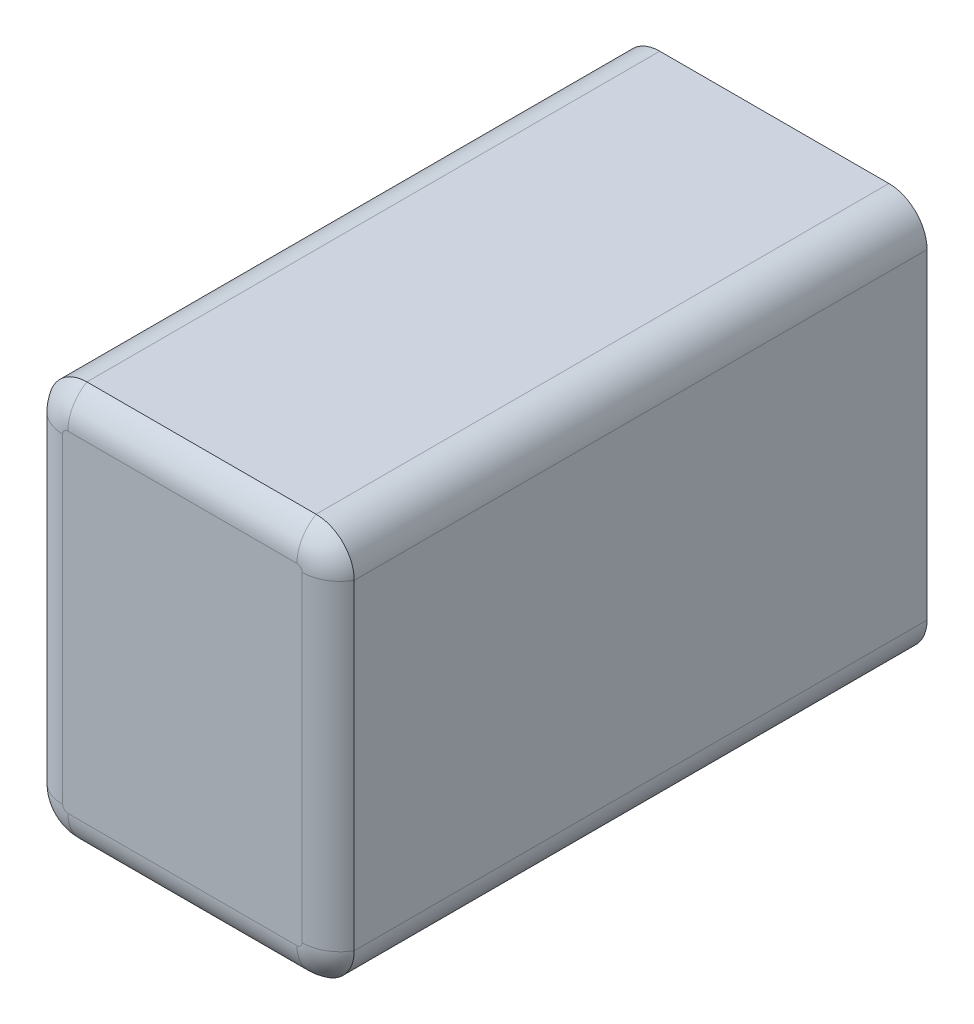
from build123d import *

# Parameters (mm, degrees)
EXTRUDE_1_DEPTH = 150
EXTRUDE_3_DEPTH = 5
EXTRUDE_3_TAPER = 28
SHELL_9_T       = -2
FILLET_22_R     = 10


with BuildPart() as part:
    # 草圖1 → 填料-伸長1 (new body)
    with BuildSketch(Plane.XY):
        with BuildLine():
            Line((-30, 52), (30, 52))
            ThreePointArc((30, 52), (37.071067812, 49.071067812), (40, 42))
            Line((40, 42), (40, -42))
            ThreePointArc((40, -42), (37.071067812, -49.071067812), (30, -52))
            Line((30, -52), (-30, -52))
            ThreePointArc((-30, -52), (-37.071067812, -49.071067812), (-40, -42))
            Line((-40, -42), (-40, 42))
            ThreePointArc((-40, 42), (-37.071067812, 49.071067812), (-30, 52))
        make_face()
    extrude(amount=EXTRUDE_1_DEPTH)

    # 草圖3 → 填料-伸長3 (add)
    with BuildSketch(Plane.XY.offset(150)):
        with BuildLine():
            ThreePointArc((-30, 52), (-37.071067812, 49.071067812), (-40, 42))
            Line((-40, 42), (-40, -42))
            ThreePointArc((-40, -42), (-37.071067812, -49.071067812), (-30, -52))
            Line((-30, -52), (30, -52))
            ThreePointArc((30, -52), (37.071067812, -49.071067812), (40, -42))
            Line((40, -42), (40, 42))
            ThreePointArc((40, 42), (37.071067812, 49.071067812), (30, 52))
            Line((30, 52), (-30, 52))
        make_face()
    extrude(amount=EXTRUDE_3_DEPTH, taper=EXTRUDE_3_TAPER)

    # 薄殼9
    shell_9_openings = [part.faces().sort_by_distance(p)[0] for p in [
        (0, 0, 0),
    ]]
    offset(amount=SHELL_9_T, openings=shell_9_openings, kind=Kind.INTERSECTION)

    # 圓角22
    # the kernel refuses this fillet: 10 mm, written as the material it takes off along each edge
    with BuildSketch(Plane(origin=(-30, -42, 155), x_dir=(-1, 0, 0), z_dir=(0, 1, 0))) as fillet_22_piece_1:
        with BuildLine():
            CenterArc((1.339745962, -10), FILLET_22_R, 30, 60)
            Line((10, -5), (10.173205081, -4.9))
            ThreePointArc((10.173205081, -4.9), (8.847315939, -2.406105687), (7.51804236, 0.093894313))
            Line((7.51804236, 0.093894313), (7.341452842, 0.2))
            Line((7.341452842, 0.2), (1.339745962, 0.2))
            Line((1.339745962, 0.2), (1.339745962, 0))
        make_face()
    revolve(axis=Axis((-30, -42, 155), (0, 0, 1)), revolution_arc=90, mode=Mode.SUBTRACT)
    with BuildSketch(Plane(origin=(-37.341452842, 42, 155), x_dir=(1, 0, 0), z_dir=(0, -1, 0)), Plane(origin=(37.341452842, -42, 155), x_dir=(-1, 0, 0), z_dir=(0, 1, 0))) as fillet_22_piece_2:
        with BuildLine():
            CenterArc((6.00170688, -10), FILLET_22_R, 90, 60)
            Line((-2.658547158, -5), (-2.831752239, -4.9))
            ThreePointArc((-2.831752239, -4.9), (-1.505863098, -2.406105687), (-0.176589519, 0.093894313))
            Line((-0.176589519, 0.093894313), (0, 0.2))
            Line((0, 0.2), (6.00170688, 0.2))
            Line((6.00170688, 0.2), (6.00170688, 0))
        make_face()
    extrude(amount=84, mode=Mode.SUBTRACT)
    with BuildSketch(Plane(origin=(-30, 42, 155), x_dir=(0, 1, 0), z_dir=(1, 0, 0))) as fillet_22_piece_3:
        with BuildLine():
            CenterArc((1.339745962, -10), FILLET_22_R, 30, 60)
            Line((1.339745962, 0), (1.339745962, 0.2))
            Line((1.339745962, 0.2), (7.341452842, 0.2))
            Line((7.341452842, 0.2), (7.51804236, 0.093894313))
            ThreePointArc((7.51804236, 0.093894313), (8.847315939, -2.406105687), (10.173205081, -4.9))
            Line((10.173205081, -4.9), (10, -5))
        make_face()
    revolve(axis=Axis((-30, 42, 155), (0, 0, 1)), revolution_arc=90, mode=Mode.SUBTRACT)
    with BuildSketch(Plane(origin=(30, 49.341452842, 155), x_dir=(0, 0.46947156278588964, -0.8829475928589275), z_dir=(-1, 0, 0))) as fillet_22_piece_4:
        with BuildLine():
            CenterArc((6.01184522, 9.99390827), FILLET_22_R, 208, 60)
            Line((-2.817630708, 5.299192642), (-2.994220227, 5.20529833))
            Line((-2.994220227, 5.20529833), (-0.176589519, -0.093894313))
            Line((-0.176589519, -0.093894313), (0, -0.2))
            ThreePointArc((0, -0.2), (2.831425127, -0.2), (5.655870354, -0.199878165))
            Line((5.655870354, -0.199878165), (5.662850253, 0))
        make_face()
    extrude(amount=60, mode=Mode.SUBTRACT)
    with BuildSketch(Plane(origin=(30, 42, 155), x_dir=(1, 0, 0), z_dir=(0, -1, 0))) as fillet_22_piece_5:
        with BuildLine():
            CenterArc((1.339745962, -10), FILLET_22_R, 30, 60)
            Line((1.339745962, 0), (1.339745962, 0.2))
            Line((1.339745962, 0.2), (7.341452842, 0.2))
            Line((7.341452842, 0.2), (7.51804236, 0.093894313))
            ThreePointArc((7.51804236, 0.093894313), (8.847315939, -2.406105687), (10.173205081, -4.9))
            Line((10.173205081, -4.9), (10, -5))
        make_face()
    revolve(axis=Axis((30, 42, 155), (0, 0, 1)), revolution_arc=90, mode=Mode.SUBTRACT)
    with BuildSketch(Plane(origin=(30, -42, 155), x_dir=(0, -1, 0), z_dir=(-1, 0, 0))) as fillet_22_piece_6:
        with BuildLine():
            CenterArc((1.339745962, -10), FILLET_22_R, 30, 60)
            Line((10, -5), (10.173205081, -4.9))
            ThreePointArc((10.173205081, -4.9), (8.847315939, -2.406105687), (7.51804236, 0.093894313))
            Line((7.51804236, 0.093894313), (7.341452842, 0.2))
            Line((7.341452842, 0.2), (1.339745962, 0.2))
            Line((1.339745962, 0.2), (1.339745962, 0))
        make_face()
    revolve(axis=Axis((30, -42, 155), (0, 0, 1)), revolution_arc=90, mode=Mode.SUBTRACT)
    with BuildSketch(Plane(origin=(-30, -49.341452842, 155), x_dir=(0, 1, 0), z_dir=(1, 0, 0))) as fillet_22_piece_7:
        with BuildLine():
            CenterArc((6.00170688, -10), FILLET_22_R, 90, 60)
            Line((-2.658547158, -5), (-2.831752239, -4.9))
            ThreePointArc((-2.831752239, -4.9), (-1.505863098, -2.406105687), (-0.176589519, 0.093894313))
            Line((-0.176589519, 0.093894313), (0, 0.2))
            Line((0, 0.2), (6.00170688, 0.2))
            Line((6.00170688, 0.2), (6.00170688, 0))
        make_face()
    extrude(amount=60, mode=Mode.SUBTRACT)


solid = part.part
